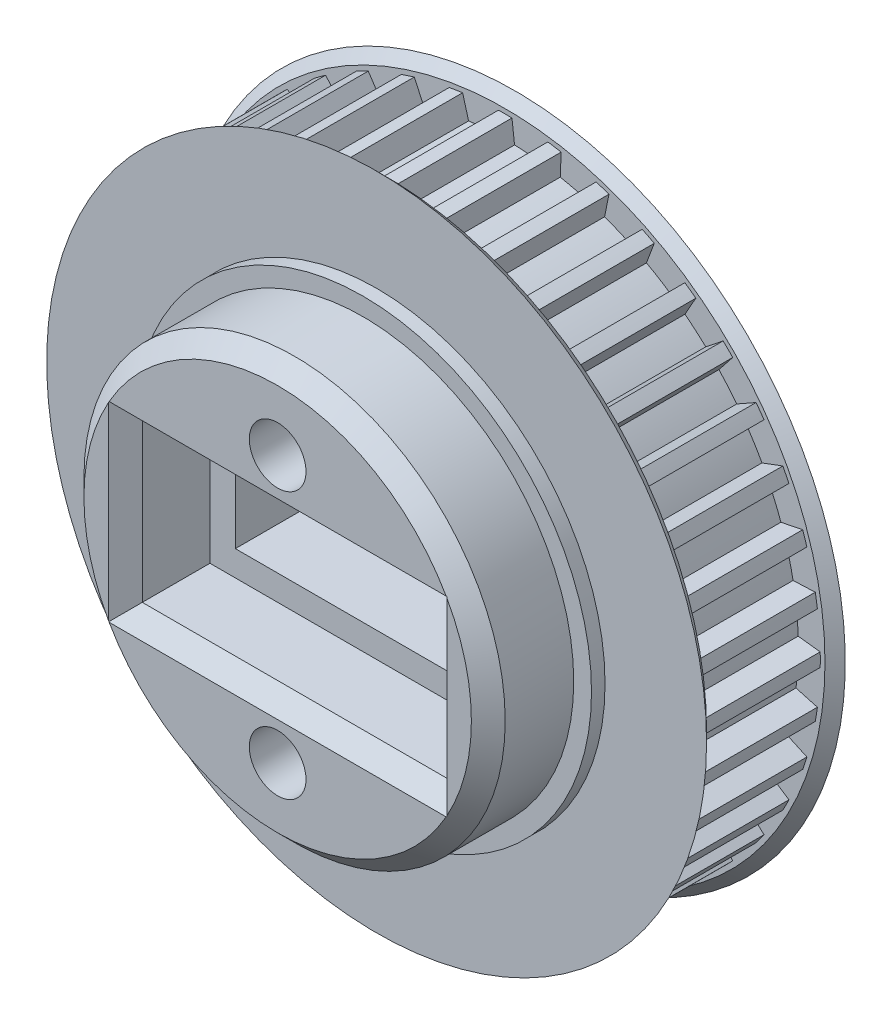
from build123d import *
from build123d.topology import SkipClean

# Parameters (mm, degrees)
CROQUIS1_R                 = 2
SALIENTE_EXTRUIR1_DEPTH    = 7
CROQUIS2_R                 = 19.5
CROQUIS2_R_2               = 2
SALIENTE_EXTRUIR2_DEPTH    = 0.6
SALIENTE_EXTRUIR4_START    = 6.2
CROQUIS4_R                 = 12.45
CROQUIS4_R_2               = 2
SALIENTE_EXTRUIR4_DEPTH    = 6.2
SALIENTE_EXTRUIR6_START    = 0.6
CROQUIS6_R                 = 19.5
CROQUIS6_R_2               = 2
SALIENTE_EXTRUIR6_DEPTH    = 0.6
SALIENTE_EXTRUIR5_START    = 0.6
CROQUIS5_R                 = 13.5
CROQUIS5_R_2               = 2
SALIENTE_EXTRUIR5_DEPTH    = 0.6
CROQUIS3_R                 = 12.45
CROQUIS3_R_2               = 2
SALIENTE_EXTRUIR7_DEPTH    = 5.85
CHAFL_N4_SIZE              = 1
CROQUIS7_R                 = 13.5
CROQUIS7_R_2               = 2
SALIENTE_EXTRUIR8_DEPTH    = 0.8
CORTAR_EXTRUIR1_DEPTH      = 31.682283161
CORTAR_EXTRUIR1_DEPTH_BACK = 31.682283161
CROQUIS8_R                 = 1.675
CROQUIS8_W                 = 15
CROQUIS8_H                 = 6.3
CORTAR_EXTRUIR2_DEPTH      = 5
REDONDEO1_R                = 2.5
CROQUIS10_W                = 18
CROQUIS10_H                = 9.3
CORTAR_EXTRUIR3_DEPTH      = 5
CHAFL_N5_SIZE              = 1
CHAFL_N6_SIZE              = 0.6


# Some blends are built 0.0001 mm under size
with BuildPart() as part:
    # Croquis1 → Saliente-Extruir1 (new body)
    with BuildSketch(Plane.XY):
        with BuildLine():
            Line((-0.4, 18.616701085), (-0.55, 17.312263428))
            ThreePointArc((-0.55, 17.312263428), (-1.358989825, 17.26760295), (-2.165006081, 17.185159693))
            Line((-2.165006081, 17.185159693), (-2.517218339, 18.450072388))
            Line((-2.517218339, 18.450072388), (-3.307369011, 18.324924816))
            Line((-3.307369011, 18.324924816), (-3.251463255, 17.013081781))
            ThreePointArc((-3.251463255, 17.013081781), (-4.043506635, 16.842417258), (-4.826702526, 16.634900292))
            Line((-4.826702526, 16.634900292), (-5.372454408, 17.829141677))
            Line((-5.372454408, 17.829141677), (-6.133299621, 17.581928081))
            Line((-6.133299621, 17.581928081), (-5.872864694, 16.294981598))
            ThreePointArc((-5.872864694, 16.294981598), (-6.628458892, 16.002515356), (-7.369549537, 15.675034438))
            Line((-7.369549537, 15.675034438), (-8.095402819, 16.769198326))
            Line((-8.095402819, 16.769198326), (-8.808208039, 16.406005926))
            Line((-8.808208039, 16.406005926), (-8.349656714, 15.175644888))
            ThreePointArc((-8.349656714, 15.175644888), (-9.050196493, 14.768578416), (-9.73093378, 14.329197213))
            Line((-9.73093378, 14.329197213), (-10.619015546, 15.296341658))
            Line((-10.619015546, 15.296341658), (-11.266229142, 14.826113456))
            Line((-11.266229142, 14.826113456), (-10.620852474, 13.682633435))
            ThreePointArc((-10.620852474, 13.682633435), (-11.24908822, 13.170990062), (-11.852710138, 12.630527597))
            Line((-11.852710138, 12.630527597), (-12.881152868, 13.446838293))
            ThreePointArc((-12.881152868, 13.446838293), (-13.167033821, 13.167033821), (-13.446838293, 12.881152868))
            Line((-13.446838293, 12.881152868), (-12.630527597, 11.852710138))
            ThreePointArc((-12.630527597, 11.852710138), (-13.170990062, 11.24908822), (-13.682633435, 10.620852474))
            Line((-13.682633435, 10.620852474), (-14.826113456, 11.266229142))
            ThreePointArc((-14.826113456, 11.266229142), (-15.064703677, 10.945147893), (-15.296341658, 10.619015546))
            Line((-15.296341658, 10.619015546), (-14.329197213, 9.73093378))
            ThreePointArc((-14.329197213, 9.73093378), (-14.768578416, 9.050196493), (-15.175644888, 8.349656714))
            Line((-15.175644888, 8.349656714), (-16.406005926, 8.808208039))
            ThreePointArc((-16.406005926, 8.808208039), (-16.591430532, 8.4537561), (-16.769198326, 8.095402819))
            Line((-16.769198326, 8.095402819), (-15.675034438, 7.369549537))
            ThreePointArc((-15.675034438, 7.369549537), (-16.002515356, 6.628458892), (-16.294981598, 5.872864694))
            Line((-16.294981598, 5.872864694), (-17.581928081, 6.133299621))
            ThreePointArc((-17.581928081, 6.133299621), (-17.709621303, 5.754204774), (-17.829141677, 5.372454408))
            Line((-17.829141677, 5.372454408), (-16.634900292, 4.826702526))
            ThreePointArc((-16.634900292, 4.826702526), (-16.842417258, 4.043506635), (-17.013081781, 3.251463255))
            Line((-17.013081781, 3.251463255), (-18.324924816, 3.307369011))
            ThreePointArc((-18.324924816, 3.307369011), (-18.391742423, 2.91296583), (-18.450072388, 2.517218339))
            Line((-18.450072388, 2.517218339), (-17.185159693, 2.165006081))
            ThreePointArc((-17.185159693, 2.165006081), (-17.26760295, 1.358989825), (-17.312263428, 0.55))
            Line((-17.312263428, 0.55), (-18.616701085, 0.4))
            ThreePointArc((-18.616701085, 0.4), (-18.620997806, 0), (-18.616701085, -0.4))
            Line((-18.616701085, -0.4), (-17.312263428, -0.55))
            ThreePointArc((-17.312263428, -0.55), (-17.26760295, -1.358989825), (-17.185159693, -2.165006081))
            Line((-17.185159693, -2.165006081), (-18.450072388, -2.517218339))
            ThreePointArc((-18.450072388, -2.517218339), (-18.391742423, -2.91296583), (-18.324924816, -3.307369011))
            Line((-18.324924816, -3.307369011), (-17.013081781, -3.251463255))
            ThreePointArc((-17.013081781, -3.251463255), (-16.842417258, -4.043506635), (-16.634900292, -4.826702526))
            Line((-16.634900292, -4.826702526), (-17.829141677, -5.372454408))
            ThreePointArc((-17.829141677, -5.372454408), (-17.709621303, -5.754204774), (-17.581928081, -6.133299621))
            Line((-17.581928081, -6.133299621), (-16.294981598, -5.872864694))
            ThreePointArc((-16.294981598, -5.872864694), (-16.002515356, -6.628458892), (-15.675034438, -7.369549537))
            Line((-15.675034438, -7.369549537), (-16.769198326, -8.095402819))
            ThreePointArc((-16.769198326, -8.095402819), (-16.591430532, -8.4537561), (-16.406005926, -8.808208039))
            Line((-16.406005926, -8.808208039), (-15.175644888, -8.349656714))
            ThreePointArc((-15.175644888, -8.349656714), (-14.768578416, -9.050196493), (-14.329197213, -9.73093378))
            Line((-14.329197213, -9.73093378), (-15.296341658, -10.619015546))
            ThreePointArc((-15.296341658, -10.619015546), (-15.064703677, -10.945147893), (-14.826113456, -11.266229142))
            Line((-14.826113456, -11.266229142), (-13.682633435, -10.620852474))
            ThreePointArc((-13.682633435, -10.620852474), (-13.170990062, -11.24908822), (-12.630527597, -11.852710138))
            Line((-12.630527597, -11.852710138), (-13.446838293, -12.881152868))
            ThreePointArc((-13.446838293, -12.881152868), (-13.167033821, -13.167033821), (-12.881152868, -13.446838293))
            Line((-12.881152868, -13.446838293), (-11.852710138, -12.630527597))
            ThreePointArc((-11.852710138, -12.630527597), (-11.24908822, -13.170990062), (-10.620852474, -13.682633435))
            Line((-10.620852474, -13.682633435), (-11.266229142, -14.826113456))
            ThreePointArc((-11.266229142, -14.826113456), (-10.945147893, -15.064703677), (-10.619015546, -15.296341658))
            Line((-10.619015546, -15.296341658), (-9.73093378, -14.329197213))
            ThreePointArc((-9.73093378, -14.329197213), (-9.050196493, -14.768578416), (-8.349656714, -15.175644888))
            Line((-8.349656714, -15.175644888), (-8.808208039, -16.406005926))
            ThreePointArc((-8.808208039, -16.406005926), (-8.4537561, -16.591430532), (-8.095402819, -16.769198326))
            Line((-8.095402819, -16.769198326), (-7.369549537, -15.675034438))
            ThreePointArc((-7.369549537, -15.675034438), (-6.628458892, -16.002515356), (-5.872864694, -16.294981598))
            Line((-5.872864694, -16.294981598), (-6.133299621, -17.581928081))
            ThreePointArc((-6.133299621, -17.581928081), (-5.754204774, -17.709621303), (-5.372454408, -17.829141677))
            Line((-5.372454408, -17.829141677), (-4.826702526, -16.634900292))
            ThreePointArc((-4.826702526, -16.634900292), (-4.043506635, -16.842417258), (-3.251463255, -17.013081781))
            Line((-3.251463255, -17.013081781), (-3.307369011, -18.324924816))
            ThreePointArc((-3.307369011, -18.324924816), (-2.91296583, -18.391742423), (-2.517218339, -18.450072388))
            Line((-2.517218339, -18.450072388), (-2.165006081, -17.185159693))
            ThreePointArc((-2.165006081, -17.185159693), (-1.358989825, -17.26760295), (-0.55, -17.312263428))
            Line((-0.55, -17.312263428), (-0.4, -18.616701085))
            ThreePointArc((-0.4, -18.616701085), (0, -18.620997806), (0.4, -18.616701085))
            Line((0.4, -18.616701085), (0.55, -17.312263428))
            ThreePointArc((0.55, -17.312263428), (1.358989825, -17.26760295), (2.165006081, -17.185159693))
            Line((2.165006081, -17.185159693), (2.517218339, -18.450072388))
            ThreePointArc((2.517218339, -18.450072388), (2.91296583, -18.391742423), (3.307369011, -18.324924816))
            Line((3.307369011, -18.324924816), (3.251463255, -17.013081781))
            ThreePointArc((3.251463255, -17.013081781), (4.043506635, -16.842417258), (4.826702526, -16.634900292))
            Line((4.826702526, -16.634900292), (5.372454408, -17.829141677))
            ThreePointArc((5.372454408, -17.829141677), (5.754204774, -17.709621303), (6.133299621, -17.581928081))
            Line((6.133299621, -17.581928081), (5.872864694, -16.294981598))
            ThreePointArc((5.872864694, -16.294981598), (6.628458892, -16.002515356), (7.369549537, -15.675034438))
            Line((7.369549537, -15.675034438), (8.095402819, -16.769198326))
            ThreePointArc((8.095402819, -16.769198326), (8.4537561, -16.591430532), (8.808208039, -16.406005926))
            Line((8.808208039, -16.406005926), (8.349656714, -15.175644888))
            ThreePointArc((8.349656714, -15.175644888), (9.050196493, -14.768578416), (9.73093378, -14.329197213))
            Line((9.73093378, -14.329197213), (10.619015546, -15.296341658))
            ThreePointArc((10.619015546, -15.296341658), (10.945147893, -15.064703677), (11.266229142, -14.826113456))
            Line((11.266229142, -14.826113456), (10.620852474, -13.682633435))
            ThreePointArc((10.620852474, -13.682633435), (11.24908822, -13.170990062), (11.852710138, -12.630527597))
            Line((11.852710138, -12.630527597), (12.881152868, -13.446838293))
            ThreePointArc((12.881152868, -13.446838293), (13.167033821, -13.167033821), (13.446838293, -12.881152868))
            Line((13.446838293, -12.881152868), (12.630527597, -11.852710138))
            ThreePointArc((12.630527597, -11.852710138), (13.170990062, -11.24908822), (13.682633435, -10.620852474))
            Line((13.682633435, -10.620852474), (14.826113456, -11.266229142))
            ThreePointArc((14.826113456, -11.266229142), (15.064703677, -10.945147893), (15.296341658, -10.619015546))
            Line((15.296341658, -10.619015546), (14.329197213, -9.73093378))
            ThreePointArc((14.329197213, -9.73093378), (14.768578416, -9.050196493), (15.175644888, -8.349656714))
            Line((15.175644888, -8.349656714), (16.406005926, -8.808208039))
            ThreePointArc((16.406005926, -8.808208039), (16.591430532, -8.4537561), (16.769198326, -8.095402819))
            Line((16.769198326, -8.095402819), (15.675034438, -7.369549537))
            ThreePointArc((15.675034438, -7.369549537), (16.002515356, -6.628458892), (16.294981598, -5.872864694))
            Line((16.294981598, -5.872864694), (17.581928081, -6.133299621))
            ThreePointArc((17.581928081, -6.133299621), (17.709621303, -5.754204774), (17.829141677, -5.372454408))
            Line((17.829141677, -5.372454408), (16.634900292, -4.826702526))
            ThreePointArc((16.634900292, -4.826702526), (16.842417258, -4.043506635), (17.013081781, -3.251463255))
            Line((17.013081781, -3.251463255), (18.324924816, -3.307369011))
            ThreePointArc((18.324924816, -3.307369011), (18.391742423, -2.91296583), (18.450072388, -2.517218339))
            Line((18.450072388, -2.517218339), (17.185159693, -2.165006081))
            ThreePointArc((17.185159693, -2.165006081), (17.26760295, -1.358989825), (17.312263428, -0.55))
            Line((17.312263428, -0.55), (18.616701085, -0.4))
            ThreePointArc((18.616701085, -0.4), (18.620997806, 0), (18.616701085, 0.4))
            Line((18.616701085, 0.4), (17.312263428, 0.55))
            ThreePointArc((17.312263428, 0.55), (17.26760295, 1.358989825), (17.185159693, 2.165006081))
            Line((17.185159693, 2.165006081), (18.450072388, 2.517218339))
            ThreePointArc((18.450072388, 2.517218339), (18.391742423, 2.91296583), (18.324924816, 3.307369011))
            Line((18.324924816, 3.307369011), (17.013081781, 3.251463255))
            ThreePointArc((17.013081781, 3.251463255), (16.842417258, 4.043506635), (16.634900292, 4.826702526))
            Line((16.634900292, 4.826702526), (17.829141677, 5.372454408))
            ThreePointArc((17.829141677, 5.372454408), (17.709621303, 5.754204774), (17.581928081, 6.133299621))
            Line((17.581928081, 6.133299621), (16.294981598, 5.872864694))
            ThreePointArc((16.294981598, 5.872864694), (16.002515356, 6.628458892), (15.675034438, 7.369549537))
            Line((15.675034438, 7.369549537), (16.769198326, 8.095402819))
            ThreePointArc((16.769198326, 8.095402819), (16.591430532, 8.4537561), (16.406005926, 8.808208039))
            Line((16.406005926, 8.808208039), (15.175644888, 8.349656714))
            ThreePointArc((15.175644888, 8.349656714), (14.768578416, 9.050196493), (14.329197213, 9.73093378))
            Line((14.329197213, 9.73093378), (15.296341658, 10.619015546))
            ThreePointArc((15.296341658, 10.619015546), (15.064703677, 10.945147893), (14.826113456, 11.266229142))
            Line((14.826113456, 11.266229142), (13.682633435, 10.620852474))
            ThreePointArc((13.682633435, 10.620852474), (13.170990062, 11.24908822), (12.630527597, 11.852710138))
            Line((12.630527597, 11.852710138), (13.446838293, 12.881152868))
            ThreePointArc((13.446838293, 12.881152868), (13.167033821, 13.167033821), (12.881152868, 13.446838293))
            Line((12.881152868, 13.446838293), (11.852710138, 12.630527597))
            ThreePointArc((11.852710138, 12.630527597), (11.24908822, 13.170990062), (10.620852474, 13.682633435))
            Line((10.620852474, 13.682633435), (11.266229142, 14.826113456))
            ThreePointArc((11.266229142, 14.826113456), (10.945147893, 15.064703677), (10.619015546, 15.296341658))
            Line((10.619015546, 15.296341658), (9.73093378, 14.329197213))
            ThreePointArc((9.73093378, 14.329197213), (9.050196493, 14.768578416), (8.349656714, 15.175644888))
            Line((8.349656714, 15.175644888), (8.808208039, 16.406005926))
            ThreePointArc((8.808208039, 16.406005926), (8.4537561, 16.591430532), (8.095402819, 16.769198326))
            Line((8.095402819, 16.769198326), (7.369549537, 15.675034438))
            ThreePointArc((7.369549537, 15.675034438), (6.628458892, 16.002515356), (5.872864694, 16.294981598))
            Line((5.872864694, 16.294981598), (6.133299621, 17.581928081))
            ThreePointArc((6.133299621, 17.581928081), (5.754204774, 17.709621303), (5.372454408, 17.829141677))
            Line((5.372454408, 17.829141677), (4.826702526, 16.634900292))
            ThreePointArc((4.826702526, 16.634900292), (4.043506635, 16.842417258), (3.251463255, 17.013081781))
            Line((3.251463255, 17.013081781), (3.307369011, 18.324924816))
            ThreePointArc((3.307369011, 18.324924816), (2.91296583, 18.391742423), (2.517218339, 18.450072388))
            Line((2.517218339, 18.450072388), (2.165006081, 17.185159693))
            ThreePointArc((2.165006081, 17.185159693), (1.358989825, 17.26760295), (0.55, 17.312263428))
            Line((0.55, 17.312263428), (0.4, 18.616701085))
            ThreePointArc((0.4, 18.616701085), (0, 18.620997806), (-0.4, 18.616701085))
        make_face()
        Circle(CROQUIS1_R, mode=Mode.SUBTRACT)
    extrude(amount=SALIENTE_EXTRUIR1_DEPTH)

    # Croquis2 → Saliente-Extruir2 (add)
    with BuildSketch(Plane.XY.offset(7)):
        Circle(CROQUIS2_R)
        Circle(CROQUIS2_R_2, mode=Mode.SUBTRACT)
    extrude(amount=SALIENTE_EXTRUIR2_DEPTH)

    # Croquis4 → Saliente-Extruir4 (add)
    with BuildSketch(Plane(origin=(0, 0, 0), x_dir=(-1, 0, 0), z_dir=(0, 0, -1)).offset(SALIENTE_EXTRUIR4_START)):
        with Locations(Location((0, 0, 0), (0, 0, 180))):
            Circle(CROQUIS4_R)
        Circle(CROQUIS4_R_2, mode=Mode.SUBTRACT)
    extrude(amount=-SALIENTE_EXTRUIR4_DEPTH)

    # Croquis6 → Saliente-Extruir6 (add)
    with SkipClean():  # the faces are left unmerged after this step: merging them gives an invalid solid
        with BuildSketch(Plane(origin=(0, 0, 0), x_dir=(-1, 0, 0), z_dir=(0, 0, -1)).offset(SALIENTE_EXTRUIR6_START)):
            with Locations(Location((0, 0, 0), (0, 0, 180))):
                Circle(CROQUIS6_R)
            Circle(CROQUIS6_R_2, mode=Mode.SUBTRACT)
        extrude(amount=-SALIENTE_EXTRUIR6_DEPTH)

    # Croquis5 → Saliente-Extruir5 (add)
    with SkipClean():  # the faces are left unmerged after this step: merging them gives an invalid solid
        with BuildSketch(Plane(origin=(0, 0, -0.6), x_dir=(-1, 0, 0), z_dir=(0, 0, -1)).offset(SALIENTE_EXTRUIR5_START)):
            Circle(CROQUIS5_R)
            Circle(CROQUIS5_R_2, mode=Mode.SUBTRACT)
        extrude(amount=-SALIENTE_EXTRUIR5_DEPTH)

    # Croquis3 → Saliente-Extruir7 (add)
    with BuildSketch(Plane.XY.offset(7.6)):
        Circle(CROQUIS3_R)
        with Locations(Location((0, 0, 0), (0, 0, 180))):
            Circle(CROQUIS3_R_2, mode=Mode.SUBTRACT)
    extrude(amount=SALIENTE_EXTRUIR7_DEPTH)

    # Chaflán4
    chafl_n4_edges = [part.edges().sort_by_distance(p)[0] for p in [
        (-12.45, 0, -6.2),
        (-12.45, 0, 13.45),
    ]]
    chamfer(chafl_n4_edges, length=CHAFL_N4_SIZE)

    # Croquis7 → Saliente-Extruir8 (add)
    with BuildSketch(Plane.XY.offset(7.6)):
        with Locations(Location((0, 0, 0), (0, 0, 180))):
            Circle(CROQUIS7_R)
        with Locations(Location((0, 0, 0), (0, 0, 180))):
            Circle(CROQUIS7_R_2, mode=Mode.SUBTRACT)
    extrude(amount=SALIENTE_EXTRUIR8_DEPTH)

    # Croquis8 → Cortar-Extruir1 (cut, two sides: drawn at the far end of the back side and taken through both)
    with BuildSketch(Plane.XY.offset(-CORTAR_EXTRUIR1_DEPTH_BACK)):
        with Locations((0, 7.875631857)):
            Circle(CROQUIS8_R)
        with Locations((0, -7.875631857)):
            Circle(CROQUIS8_R)
        Rectangle(CROQUIS8_W, CROQUIS8_H)
    extrude(amount=CORTAR_EXTRUIR1_DEPTH + CORTAR_EXTRUIR1_DEPTH_BACK, mode=Mode.SUBTRACT)

    # Croquis9 → Cortar-Extruir2 (cut)
    with BuildSketch(Plane(origin=(0, 0, -6.2), x_dir=(-1, 0, 0), z_dir=(0, 0, -1))):
        Polygon((2.33826859, 3.825631857), (4.67653718, 7.875631857), (2.33826859, 11.925631857), (-2.33826859, 11.925631857), (-4.67653718, 7.875631857), (-2.33826859, 3.825631857), align=None)
        Polygon((2.33826859, -11.925631857), (4.67653718, -7.875631857), (2.33826859, -3.825631857), (-2.33826859, -3.825631857), (-4.67653718, -7.875631857), (-2.33826859, -11.925631857), align=None)
    extrude(amount=-CORTAR_EXTRUIR2_DEPTH, mode=Mode.SUBTRACT)

    # Redondeo1
    redondeo1_edges = [part.edges().sort_by_distance(p)[0] for p in [
        (0, 3.825631857, -1.2),
        (3.507402885, 5.850631857, -1.2),
        (3.507402885, 9.900631857, -1.2),
        (0, 11.925631857, -1.2),
        (-3.507402885, 9.900631857, -1.2),
        (-3.507402885, 5.850631857, -1.2),
        (0, -11.925631857, -1.2),
        (3.507402885, -9.900631857, -1.2),
        (3.507402885, -5.850631857, -1.2),
        (0, -3.825631857, -1.2),
        (-3.507402885, -5.850631857, -1.2),
        (-3.507402885, -9.900631857, -1.2),
    ]]
    fillet(redondeo1_edges, radius=REDONDEO1_R)

    # Croquis10 → Cortar-Extruir3 (cut)
    with BuildSketch(Plane.XY.offset(13.45)):
        Rectangle(CROQUIS10_W, CROQUIS10_H)
    extrude(amount=-CORTAR_EXTRUIR3_DEPTH, mode=Mode.SUBTRACT)

    # Chaflán5
    # the kernel refuses this chamfer: 1 mm, written as the material it takes off along each edge
    with BuildSketch(Plane(origin=(-7.5, -3.15, -6.2), x_dir=(-0.9996219169112968, 0, -0.02749587661058651), z_dir=(0, 1, 0)), Plane(origin=(7.5, 3.15, -6.2), x_dir=(0.9996219169112968, 0, -0.02749587661058651), z_dir=(0, -1, 0))) as chafl_n5_piece_1:
        Polygon((CHAFL_N5_SIZE * 0.999621916911, CHAFL_N5_SIZE * 0.0274958766106), (-CHAFL_N5_SIZE * 0.0274958766106, CHAFL_N5_SIZE * 0.999621916911), (0, 0), align=None)
    extrude(amount=6.3, mode=Mode.SUBTRACT)
    with BuildSketch(Plane(origin=(-7.5, 3.15, -6.2), x_dir=(0, 0.9996219169112968, -0.027495876610586487), z_dir=(1, 0, 0)), Plane(origin=(7.5, -3.15, -6.2), x_dir=(0, -0.9996219169112968, -0.027495876610586487), z_dir=(-1, 0, 0))) as chafl_n5_piece_2:
        Polygon((CHAFL_N5_SIZE * 0.999621916911, CHAFL_N5_SIZE * 0.0274958766106), (-CHAFL_N5_SIZE * 0.0274958766106, CHAFL_N5_SIZE * 0.999621916911), (0, 0), align=None)
    extrude(amount=15, mode=Mode.SUBTRACT)
    with BuildSketch(Plane(origin=(9, -4.65, 13.45), x_dir=(0.9996219169112968, 0, 0.027495876610585647), z_dir=(0, 1, 0)), Plane(origin=(-9, 4.65, 13.45), x_dir=(-0.9996219169112968, 0, 0.027495876610585647), z_dir=(0, -1, 0))) as chafl_n5_piece_3:
        Polygon((CHAFL_N5_SIZE * 0.999621916911, CHAFL_N5_SIZE * 0.0274958766106), (-CHAFL_N5_SIZE * 0.0274958766106, CHAFL_N5_SIZE * 0.999621916911), (0, 0), align=None)
    extrude(amount=9.3, mode=Mode.SUBTRACT)
    with BuildSketch(Plane(origin=(9, 4.65, 13.45), x_dir=(0, 0.9996219169112968, 0.027495876610585623), z_dir=(-1, 0, 0)), Plane(origin=(-9, -4.65, 13.45), x_dir=(0, -0.9996219169112968, 0.027495876610585623), z_dir=(1, 0, 0))) as chafl_n5_piece_4:
        Polygon((CHAFL_N5_SIZE * 0.999621916911, CHAFL_N5_SIZE * 0.0274958766106), (-CHAFL_N5_SIZE * 0.0274958766106, CHAFL_N5_SIZE * 0.999621916911), (0, 0), align=None)
    extrude(amount=18, mode=Mode.SUBTRACT)
    with BuildSketch(Plane(origin=(-7.5, -5.721682988, -6.2), x_dir=(-0.9996219169112968, 0, -0.02749587661058651), z_dir=(0, 1, 0))) as chafl_n5_piece_5a_section:
        Polygon((CHAFL_N5_SIZE * 0.999621916911, CHAFL_N5_SIZE * 0.0274958766106), (-CHAFL_N5_SIZE * 0.0274958766106, CHAFL_N5_SIZE * 0.999621916911), (0, 0), align=None)
    chafl_n5_piece_5a = extrude(amount=8.871682988, mode=Mode.PRIVATE)
    chafl_n5_piece_5a = split(chafl_n5_piece_5a, bisect_by=Plane(origin=(-7.829793627, -3.15, -5.870206373), z_dir=(0, -1, 0)), keep=Keep.TOP, mode=Mode.PRIVATE)
    with BuildSketch(Plane(origin=(7.5, -3.15, -6.2), x_dir=(0, -0.9996219169112968, -0.027495876610586487), z_dir=(-1, 0, 0))) as chafl_n5_piece_5b_section:
        Polygon((CHAFL_N5_SIZE * 0.999621916911, CHAFL_N5_SIZE * 0.0274958766106), (-CHAFL_N5_SIZE * 0.0274958766106, CHAFL_N5_SIZE * 0.999621916911), (0, 0), align=None)
    chafl_n5_piece_5b = extrude(amount=17.571682988, mode=Mode.PRIVATE)
    chafl_n5_piece_5b = split(chafl_n5_piece_5b, bisect_by=Plane(origin=(-7.5, -3.479793627, -5.870206373), z_dir=(-1, 0, 0)), keep=Keep.TOP, mode=Mode.PRIVATE)
    chafl_n5_piece_5 = chafl_n5_piece_5a & chafl_n5_piece_5b
    add(chafl_n5_piece_5, mode=Mode.SUBTRACT)
    with BuildSketch(Plane(origin=(-10.071682988, 3.15, -6.2), x_dir=(0, 0.9996219169112968, -0.027495876610586487), z_dir=(1, 0, 0))) as chafl_n5_piece_6a_section:
        Polygon((CHAFL_N5_SIZE * 0.999621916911, CHAFL_N5_SIZE * 0.0274958766106), (-CHAFL_N5_SIZE * 0.0274958766106, CHAFL_N5_SIZE * 0.999621916911), (0, 0), align=None)
    chafl_n5_piece_6a = extrude(amount=17.571682988, mode=Mode.PRIVATE)
    chafl_n5_piece_6a = split(chafl_n5_piece_6a, bisect_by=Plane(origin=(-7.5, 3.479793627, -5.870206373), z_dir=(-1, 0, 0)), keep=Keep.TOP, mode=Mode.PRIVATE)
    with BuildSketch(Plane(origin=(-7.5, -3.15, -6.2), x_dir=(-0.9996219169112968, 0, -0.02749587661058651), z_dir=(0, 1, 0))) as chafl_n5_piece_6b_section:
        Polygon((CHAFL_N5_SIZE * 0.999621916911, CHAFL_N5_SIZE * 0.0274958766106), (-CHAFL_N5_SIZE * 0.0274958766106, CHAFL_N5_SIZE * 0.999621916911), (0, 0), align=None)
    chafl_n5_piece_6b = extrude(amount=8.871682988, mode=Mode.PRIVATE)
    chafl_n5_piece_6b = split(chafl_n5_piece_6b, bisect_by=Plane(origin=(-7.829793627, 3.15, -5.870206373), z_dir=(0, 1, 0)), keep=Keep.TOP, mode=Mode.PRIVATE)
    chafl_n5_piece_6 = chafl_n5_piece_6a & chafl_n5_piece_6b
    add(chafl_n5_piece_6, mode=Mode.SUBTRACT)
    with BuildSketch(Plane(origin=(-7.5, 3.15, -6.2), x_dir=(0, 0.9996219169112968, -0.027495876610586487), z_dir=(1, 0, 0))) as chafl_n5_piece_7a_section:
        Polygon((CHAFL_N5_SIZE * 0.999621916911, CHAFL_N5_SIZE * 0.0274958766106), (-CHAFL_N5_SIZE * 0.0274958766106, CHAFL_N5_SIZE * 0.999621916911), (0, 0), align=None)
    chafl_n5_piece_7a = extrude(amount=17.571682988, mode=Mode.PRIVATE)
    chafl_n5_piece_7a = split(chafl_n5_piece_7a, bisect_by=Plane(origin=(7.5, 3.479793627, -5.870206373), z_dir=(1, 0, 0)), keep=Keep.TOP, mode=Mode.PRIVATE)
    with BuildSketch(Plane(origin=(7.5, 5.721682988, -6.2), x_dir=(0.9996219169112968, 0, -0.02749587661058651), z_dir=(0, -1, 0))) as chafl_n5_piece_7b_section:
        Polygon((CHAFL_N5_SIZE * 0.999621916911, CHAFL_N5_SIZE * 0.0274958766106), (-CHAFL_N5_SIZE * 0.0274958766106, CHAFL_N5_SIZE * 0.999621916911), (0, 0), align=None)
    chafl_n5_piece_7b = extrude(amount=8.871682988, mode=Mode.PRIVATE)
    chafl_n5_piece_7b = split(chafl_n5_piece_7b, bisect_by=Plane(origin=(7.829793627, 3.15, -5.870206373), z_dir=(0, 1, 0)), keep=Keep.TOP, mode=Mode.PRIVATE)
    chafl_n5_piece_7 = chafl_n5_piece_7a & chafl_n5_piece_7b
    add(chafl_n5_piece_7, mode=Mode.SUBTRACT)
    with BuildSketch(Plane(origin=(7.5, 3.15, -6.2), x_dir=(0.9996219169112968, 0, -0.02749587661058651), z_dir=(0, -1, 0))) as chafl_n5_piece_8a_section:
        Polygon((CHAFL_N5_SIZE * 0.999621916911, CHAFL_N5_SIZE * 0.0274958766106), (-CHAFL_N5_SIZE * 0.0274958766106, CHAFL_N5_SIZE * 0.999621916911), (0, 0), align=None)
    chafl_n5_piece_8a = extrude(amount=8.871682988, mode=Mode.PRIVATE)
    chafl_n5_piece_8a = split(chafl_n5_piece_8a, bisect_by=Plane(origin=(7.829793627, -3.15, -5.870206373), z_dir=(0, -1, 0)), keep=Keep.TOP, mode=Mode.PRIVATE)
    with BuildSketch(Plane(origin=(10.071682988, -3.15, -6.2), x_dir=(0, -0.9996219169112968, -0.027495876610586487), z_dir=(-1, 0, 0))) as chafl_n5_piece_8b_section:
        Polygon((CHAFL_N5_SIZE * 0.999621916911, CHAFL_N5_SIZE * 0.0274958766106), (-CHAFL_N5_SIZE * 0.0274958766106, CHAFL_N5_SIZE * 0.999621916911), (0, 0), align=None)
    chafl_n5_piece_8b = extrude(amount=17.571682988, mode=Mode.PRIVATE)
    chafl_n5_piece_8b = split(chafl_n5_piece_8b, bisect_by=Plane(origin=(7.5, -3.479793627, -5.870206373), z_dir=(1, 0, 0)), keep=Keep.TOP, mode=Mode.PRIVATE)
    chafl_n5_piece_8 = chafl_n5_piece_8a & chafl_n5_piece_8b
    add(chafl_n5_piece_8, mode=Mode.SUBTRACT)
    with BuildSketch(Plane(origin=(-9, -4.65, 13.45), x_dir=(0, -0.9996219169112968, 0.027495876610585623), z_dir=(1, 0, 0))) as chafl_n5_piece_9a_section:
        Polygon((CHAFL_N5_SIZE * 0.999621916911, CHAFL_N5_SIZE * 0.0274958766106), (-CHAFL_N5_SIZE * 0.0274958766106, CHAFL_N5_SIZE * 0.999621916911), (0, 0), align=None)
    chafl_n5_piece_9a = extrude(amount=20.571682988, mode=Mode.PRIVATE)
    chafl_n5_piece_9a = split(chafl_n5_piece_9a, bisect_by=Plane(origin=(9, -4.979793627, 13.120206373), z_dir=(1, 0, 0)), keep=Keep.TOP, mode=Mode.PRIVATE)
    with BuildSketch(Plane(origin=(9, -7.221682988, 13.45), x_dir=(0.9996219169112968, 0, 0.027495876610585647), z_dir=(0, 1, 0))) as chafl_n5_piece_9b_section:
        Polygon((CHAFL_N5_SIZE * 0.999621916911, CHAFL_N5_SIZE * 0.0274958766106), (-CHAFL_N5_SIZE * 0.0274958766106, CHAFL_N5_SIZE * 0.999621916911), (0, 0), align=None)
    chafl_n5_piece_9b = extrude(amount=11.871682988, mode=Mode.PRIVATE)
    chafl_n5_piece_9b = split(chafl_n5_piece_9b, bisect_by=Plane(origin=(9.329793627, -4.65, 13.120206373), z_dir=(0, -1, 0)), keep=Keep.TOP, mode=Mode.PRIVATE)
    chafl_n5_piece_9 = chafl_n5_piece_9a & chafl_n5_piece_9b
    add(chafl_n5_piece_9, mode=Mode.SUBTRACT)
    with BuildSketch(Plane(origin=(11.571682988, 4.65, 13.45), x_dir=(0, 0.9996219169112968, 0.027495876610585623), z_dir=(-1, 0, 0))) as chafl_n5_piece_10a_section:
        Polygon((CHAFL_N5_SIZE * 0.999621916911, CHAFL_N5_SIZE * 0.0274958766106), (-CHAFL_N5_SIZE * 0.0274958766106, CHAFL_N5_SIZE * 0.999621916911), (0, 0), align=None)
    chafl_n5_piece_10a = extrude(amount=20.571682988, mode=Mode.PRIVATE)
    chafl_n5_piece_10a = split(chafl_n5_piece_10a, bisect_by=Plane(origin=(9, 4.979793627, 13.120206373), z_dir=(1, 0, 0)), keep=Keep.TOP, mode=Mode.PRIVATE)
    with BuildSketch(Plane(origin=(9, -4.65, 13.45), x_dir=(0.9996219169112968, 0, 0.027495876610585647), z_dir=(0, 1, 0))) as chafl_n5_piece_10b_section:
        Polygon((CHAFL_N5_SIZE * 0.999621916911, CHAFL_N5_SIZE * 0.0274958766106), (-CHAFL_N5_SIZE * 0.0274958766106, CHAFL_N5_SIZE * 0.999621916911), (0, 0), align=None)
    chafl_n5_piece_10b = extrude(amount=11.871682988, mode=Mode.PRIVATE)
    chafl_n5_piece_10b = split(chafl_n5_piece_10b, bisect_by=Plane(origin=(9.329793627, 4.65, 13.120206373), z_dir=(0, 1, 0)), keep=Keep.TOP, mode=Mode.PRIVATE)
    chafl_n5_piece_10 = chafl_n5_piece_10a & chafl_n5_piece_10b
    add(chafl_n5_piece_10, mode=Mode.SUBTRACT)
    with BuildSketch(Plane(origin=(9, 4.65, 13.45), x_dir=(0, 0.9996219169112968, 0.027495876610585623), z_dir=(-1, 0, 0))) as chafl_n5_piece_11a_section:
        Polygon((CHAFL_N5_SIZE * 0.999621916911, CHAFL_N5_SIZE * 0.0274958766106), (-CHAFL_N5_SIZE * 0.0274958766106, CHAFL_N5_SIZE * 0.999621916911), (0, 0), align=None)
    chafl_n5_piece_11a = extrude(amount=20.571682988, mode=Mode.PRIVATE)
    chafl_n5_piece_11a = split(chafl_n5_piece_11a, bisect_by=Plane(origin=(-9, 4.979793627, 13.120206373), z_dir=(-1, 0, 0)), keep=Keep.TOP, mode=Mode.PRIVATE)
    with BuildSketch(Plane(origin=(-9, 7.221682988, 13.45), x_dir=(-0.9996219169112968, 0, 0.027495876610585647), z_dir=(0, -1, 0))) as chafl_n5_piece_11b_section:
        Polygon((CHAFL_N5_SIZE * 0.999621916911, CHAFL_N5_SIZE * 0.0274958766106), (-CHAFL_N5_SIZE * 0.0274958766106, CHAFL_N5_SIZE * 0.999621916911), (0, 0), align=None)
    chafl_n5_piece_11b = extrude(amount=11.871682988, mode=Mode.PRIVATE)
    chafl_n5_piece_11b = split(chafl_n5_piece_11b, bisect_by=Plane(origin=(-9.329793627, 4.65, 13.120206373), z_dir=(0, 1, 0)), keep=Keep.TOP, mode=Mode.PRIVATE)
    chafl_n5_piece_11 = chafl_n5_piece_11a & chafl_n5_piece_11b
    add(chafl_n5_piece_11, mode=Mode.SUBTRACT)
    with BuildSketch(Plane(origin=(-9, 4.65, 13.45), x_dir=(-0.9996219169112968, 0, 0.027495876610585647), z_dir=(0, -1, 0))) as chafl_n5_piece_12a_section:
        Polygon((CHAFL_N5_SIZE * 0.999621916911, CHAFL_N5_SIZE * 0.0274958766106), (-CHAFL_N5_SIZE * 0.0274958766106, CHAFL_N5_SIZE * 0.999621916911), (0, 0), align=None)
    chafl_n5_piece_12a = extrude(amount=11.871682988, mode=Mode.PRIVATE)
    chafl_n5_piece_12a = split(chafl_n5_piece_12a, bisect_by=Plane(origin=(-9.329793627, -4.65, 13.120206373), z_dir=(0, -1, 0)), keep=Keep.TOP, mode=Mode.PRIVATE)
    with BuildSketch(Plane(origin=(-11.571682988, -4.65, 13.45), x_dir=(0, -0.9996219169112968, 0.027495876610585623), z_dir=(1, 0, 0))) as chafl_n5_piece_12b_section:
        Polygon((CHAFL_N5_SIZE * 0.999621916911, CHAFL_N5_SIZE * 0.0274958766106), (-CHAFL_N5_SIZE * 0.0274958766106, CHAFL_N5_SIZE * 0.999621916911), (0, 0), align=None)
    chafl_n5_piece_12b = extrude(amount=20.571682988, mode=Mode.PRIVATE)
    chafl_n5_piece_12b = split(chafl_n5_piece_12b, bisect_by=Plane(origin=(-9, -4.979793627, 13.120206373), z_dir=(-1, 0, 0)), keep=Keep.TOP, mode=Mode.PRIVATE)
    chafl_n5_piece_12 = chafl_n5_piece_12a & chafl_n5_piece_12b
    add(chafl_n5_piece_12, mode=Mode.SUBTRACT)

    # Chaflán6
    chafl_n6_edges = [part.edges().sort_by_distance(p)[0] for p in [
        (-19.5, 0, 7),
        (-19.5, 0, 0),
    ]]
    chamfer(chafl_n6_edges, length=CHAFL_N6_SIZE - 0.0001)  # a hair under: the kernel refuses the full size


solid = part.part
